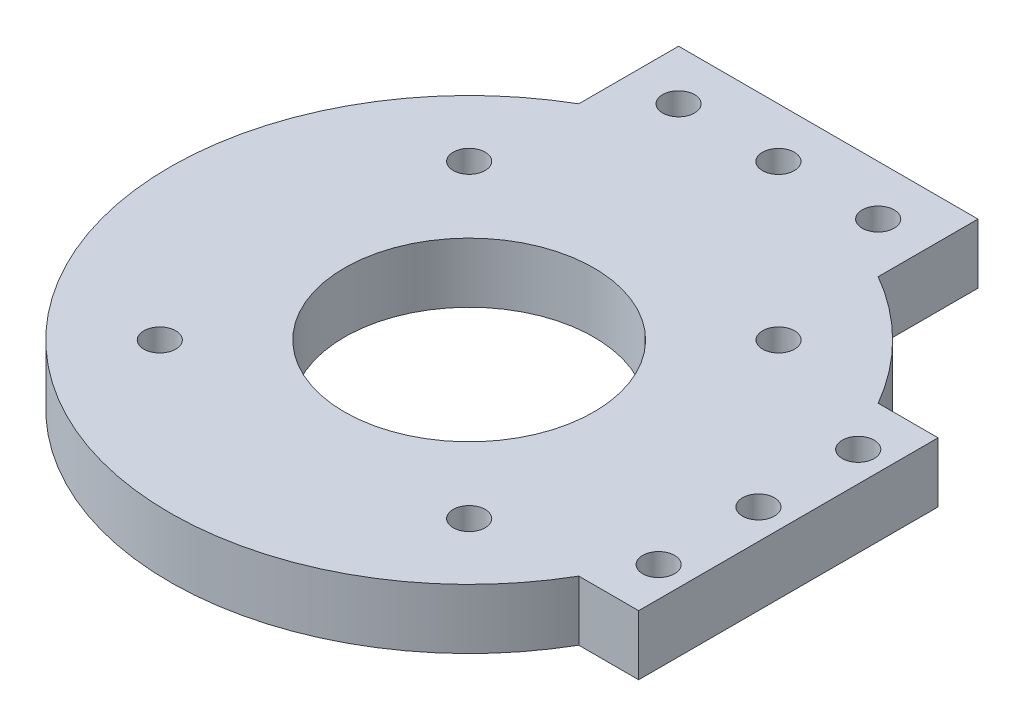
from build123d import *

# Parameters (mm, degrees)
EXTRUDE_1_DEPTH     = 6
SKETCH_2_R          = 1.6
CUT_EXTRUDE_1_DEPTH = 6
SKETCH_3_R          = 12.5
CUT_EXTRUDE_2_DEPTH = 10


# Read off the part's stored shape, not the designer's step: 凸台-拉伸1
with BuildPart() as part:
    # 凸台-拉伸1 outline → 凸台-拉伸1 (new body)
    with BuildSketch(Plane(origin=(0, 0, 0), x_dir=(1, 0, 0), z_dir=(0, 1, 0))):
        with BuildLine():
            ThreePointArc((-15, 25.980762114), (-21.213203436, -21.213203436), (25.980762114, -15))
            Line((25.980762114, -15), (31.980762114, -15))
            Line((31.980762114, -15), (31.980762114, 15))
            Line((31.980762114, 15), (25.980762114, 15))
            ThreePointArc((25.980762114, 15), (21.213203436, 21.213203436), (15, 25.980762114))
            Line((15, 25.980762114), (15, 35.980762114))
            Line((15, 35.980762114), (-15, 35.980762114))
            Line((-15, 35.980762114), (-15, 25.980762114))
        make_face()
    extrude(amount=EXTRUDE_1_DEPTH)

    # 草图2 → 切除-拉伸1 (cut)
    with BuildSketch(Plane(origin=(0, 6, 0), x_dir=(1, 0, 0), z_dir=(0, 1, 0))):
        with Locations(Location((28.980762114, 10, 0), (0, 0, 270))):
            Circle(SKETCH_2_R)
        with Locations(Location((-15.5, 15.5, 0), (0, 0, 270))):
            Circle(SKETCH_2_R)
        with Locations(Location((15.5, 15.5, 0), (0, 0, 270))):
            Circle(SKETCH_2_R)
        with Locations(Location((-15.5, -15.5, 0), (0, 0, 270))):
            Circle(SKETCH_2_R)
        with Locations(Location((15.5, -15.5, 0), (0, 0, 270))):
            Circle(SKETCH_2_R)
        with Locations(Location((28.980762114, 0, 0), (0, 0, 270))):
            Circle(SKETCH_2_R)
        with Locations(Location((28.980762114, -10, 0), (0, 0, 270))):
            Circle(SKETCH_2_R)
        with Locations(Location((-10, 30.980762114, 0), (0, 0, 270))):
            Circle(SKETCH_2_R)
        with Locations(Location((0, 30.980762114, 0), (0, 0, 270))):
            Circle(SKETCH_2_R)
        with Locations(Location((10, 30.980762114, 0), (0, 0, 270))):
            Circle(SKETCH_2_R)
    extrude(amount=-CUT_EXTRUDE_1_DEPTH, mode=Mode.SUBTRACT)

    # 草图3 → 切除-拉伸2 (cut)
    with BuildSketch(Plane(origin=(0, 6, 0), x_dir=(1, 0, 0), z_dir=(0, 1, 0))):
        with Locations(Location((0, 0, 0), (0, 0, 270))):
            Circle(SKETCH_3_R)
    extrude(amount=-CUT_EXTRUDE_2_DEPTH, mode=Mode.SUBTRACT)


solid = part.part
